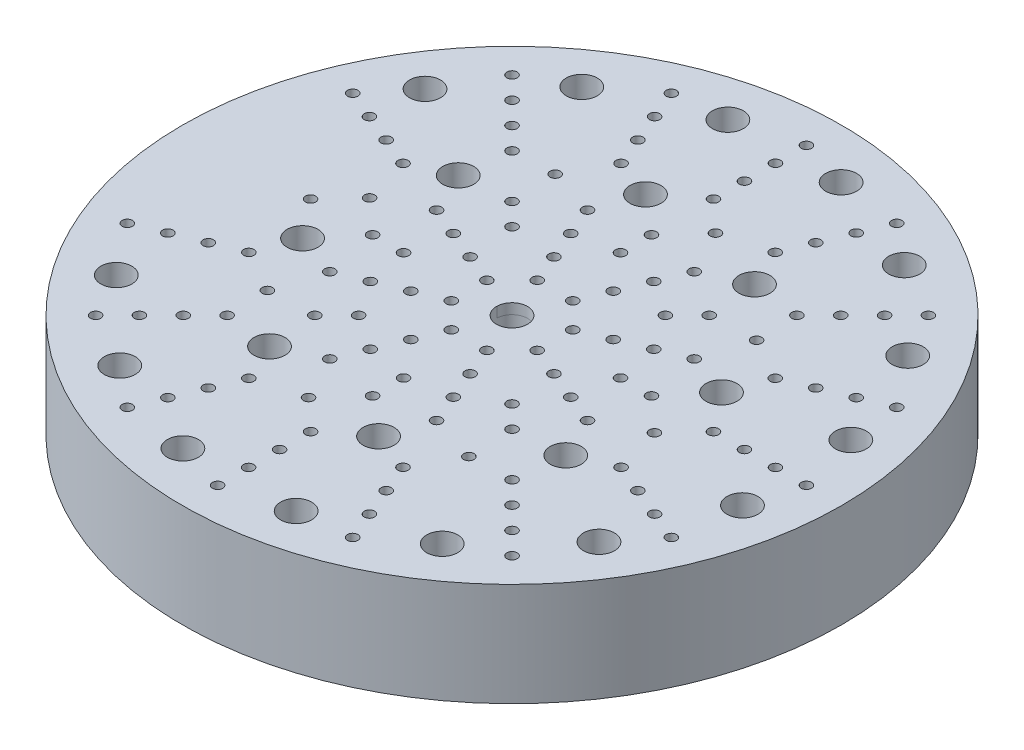
from build123d import *
from OCP.BRepAlgoAPI import BRepAlgoAPI_Cut
from OCP.TopTools import TopTools_ListOfShape
from build123d.topology import SkipClean

# Parameters (mm, degrees)
SKETCH2_R           = 31.9
SKETCH2_R_2         = 1.5
BOSS_EXTRUDE1_DEPTH = 5
CUT_EXTRUDE3_START  = -40
SKETCH3_R           = 3.5
CUT_EXTRUDE3_DEPTH  = 9
SHELL6_START        = -4.26
SHELL6_OUTLINE_R    = 2.24
SHELL6_DEPTH        = 8.52
SHELL6_START_2      = 2.834074074
SHELL6_2_DEPTH      = 1.425925926
SHELL6_3_DEPTH      = 1.425921957
SHELL6_START_3      = -31.1600001
SHELL6_4_DEPTH      = 0.1600001
SKETCH5_R           = 0.5
SKETCH5_R_2         = 1.5
CUT_EXTRUDE4_DEPTH  = 1
BOSS_EXTRUDE2_START = -31.9
SKETCH6_R           = 5
SKETCH6_R_2         = 3
BOSS_EXTRUDE2_DEPTH = 7.5
THREAD1_PITCH       = 1


with BuildPart() as part:
    # Sketch2 → Boss-Extrude1 (new, symmetric)
    with BuildSketch(Plane(origin=(0, 0, 0), x_dir=(1, 0, 0), z_dir=(0, 1, 0))):
        with Locations(Location((0, 0, 0), (0, 0, 270))):
            Circle(SKETCH2_R)
        with Locations(Location((0, 0, 0), (0, 0, 270))):
            Circle(SKETCH2_R_2, mode=Mode.SUBTRACT)
        with Locations(Location((-4.775324886, -27.082213208, 0), (0, 0, 270))):
            Circle(SKETCH2_R_2, mode=Mode.SUBTRACT)
        with Locations(Location((-9.134093342, -14.337654579, 0), (0, 0, 270))):
            Circle(SKETCH2_R_2, mode=Mode.SUBTRACT)
        with Locations(Location((-14.77573923, -23.19326476, 0), (0, 0, 270))):
            Circle(SKETCH2_R_2, mode=Mode.SUBTRACT)
        with Locations(Location((-22.526681218, -15.773352, 0), (0, 0, 270))):
            Circle(SKETCH2_R_2, mode=Mode.SUBTRACT)
        with Locations(Location((-16.597032121, -3.679473437, 0), (0, 0, 270))):
            Circle(SKETCH2_R_2, mode=Mode.SUBTRACT)
        with Locations(Location((-14.337654579, 9.134093342, 0), (0, 0, 270))):
            Circle(SKETCH2_R_2, mode=Mode.SUBTRACT)
        with Locations(Location((-23.19326476, 14.77573923, 0), (0, 0, 270))):
            Circle(SKETCH2_R_2, mode=Mode.SUBTRACT)
        with Locations(Location((-15.773352, 22.526681218, 0), (0, 0, 270))):
            Circle(SKETCH2_R_2, mode=Mode.SUBTRACT)
        with Locations(Location((-3.679473437, 16.597032121, 0), (0, 0, 270))):
            Circle(SKETCH2_R_2, mode=Mode.SUBTRACT)
        with Locations(Location((-5.952089383, 26.848140196, 0), (0, 0, 270))):
            Circle(SKETCH2_R_2, mode=Mode.SUBTRACT)
        with Locations(Location((4.775324886, 27.082213208, 0), (0, 0, 270))):
            Circle(SKETCH2_R_2, mode=Mode.SUBTRACT)
        with Locations(Location((9.134093342, 14.337654579, 0), (0, 0, 270))):
            Circle(SKETCH2_R_2, mode=Mode.SUBTRACT)
        with Locations(Location((14.77573923, 23.19326476, 0), (0, 0, 270))):
            Circle(SKETCH2_R_2, mode=Mode.SUBTRACT)
        with Locations(Location((22.526681218, 15.773352, 0), (0, 0, 270))):
            Circle(SKETCH2_R_2, mode=Mode.SUBTRACT)
        with Locations(Location((16.597032121, 3.679473437, 0), (0, 0, 270))):
            Circle(SKETCH2_R_2, mode=Mode.SUBTRACT)
        with Locations(Location((26.848140196, 5.952089383, 0), (0, 0, 270))):
            Circle(SKETCH2_R_2, mode=Mode.SUBTRACT)
        with Locations(Location((27.082213208, -4.775324886, 0), (0, 0, 270))):
            Circle(SKETCH2_R_2, mode=Mode.SUBTRACT)
        with Locations(Location((14.337654579, -9.134093342, 0), (0, 0, 270))):
            Circle(SKETCH2_R_2, mode=Mode.SUBTRACT)
        with Locations(Location((23.19326476, -14.77573923, 0), (0, 0, 270))):
            Circle(SKETCH2_R_2, mode=Mode.SUBTRACT)
        with Locations(Location((15.773352, -22.526681218, 0), (0, 0, 270))):
            Circle(SKETCH2_R_2, mode=Mode.SUBTRACT)
        with Locations(Location((3.679473437, -16.597032121, 0), (0, 0, 270))):
            Circle(SKETCH2_R_2, mode=Mode.SUBTRACT)
        with Locations(Location((5.952089383, -26.848140196, 0), (0, 0, 270))):
            Circle(SKETCH2_R_2, mode=Mode.SUBTRACT)
    extrude(amount=BOSS_EXTRUDE1_DEPTH, both=True)

    # Sketch3 → Cut-Extrude3 (cut)
    with BuildSketch(Plane(origin=(0, 0, 0), x_dir=(0, 0, -1), z_dir=(1, 0, 0)).offset(CUT_EXTRUDE3_START)):
        with Locations(Location((0, 0, 0), (0, 0, 180))):
            Circle(SKETCH3_R)
    extrude(amount=CUT_EXTRUDE3_DEPTH, mode=Mode.SUBTRACT)


with BuildPart() as shell6_tool:
    # Shell6: read off the stored shape, not the designer's step
    # Shell6 outline → Shell6 (new body)
    with BuildSketch(Plane(origin=(0, 0, 0), x_dir=(1, 0, 0), z_dir=(0, 1, 0)).offset(SHELL6_START)):
        with BuildLine():
            Line((-31, 3.153664535), (-31, -3.153664535))
            ThreePointArc((-31, -3.153664535), (31.16, 0), (-31, 3.153664535))
        make_face()
        with Locations((-22.526681218, -15.773352)):
            Circle(SHELL6_OUTLINE_R, mode=Mode.SUBTRACT)
        with Locations((-4.775324886, -27.082213208)):
            Circle(SHELL6_OUTLINE_R, mode=Mode.SUBTRACT)
        with Locations((-14.77573923, -23.19326476)):
            Circle(SHELL6_OUTLINE_R, mode=Mode.SUBTRACT)
        with Locations((-16.597032121, -3.679473437)):
            Circle(SHELL6_OUTLINE_R, mode=Mode.SUBTRACT)
        with Locations((-9.134093342, -14.337654579)):
            Circle(SHELL6_OUTLINE_R, mode=Mode.SUBTRACT)
        with Locations((5.952089383, -26.848140196)):
            Circle(SHELL6_OUTLINE_R, mode=Mode.SUBTRACT)
        with Locations((3.679473437, -16.597032121)):
            Circle(SHELL6_OUTLINE_R, mode=Mode.SUBTRACT)
        with Locations((15.773352, -22.526681218)):
            Circle(SHELL6_OUTLINE_R, mode=Mode.SUBTRACT)
        with Locations((14.337654579, -9.134093342)):
            Circle(SHELL6_OUTLINE_R, mode=Mode.SUBTRACT)
        with Locations((23.19326476, -14.77573923)):
            Circle(SHELL6_OUTLINE_R, mode=Mode.SUBTRACT)
        with Locations((27.082213208, -4.775324886)):
            Circle(SHELL6_OUTLINE_R, mode=Mode.SUBTRACT)
        with Locations((-23.19326476, 14.77573923)):
            Circle(SHELL6_OUTLINE_R, mode=Mode.SUBTRACT)
        with Locations((-14.337654579, 9.134093342)):
            Circle(SHELL6_OUTLINE_R, mode=Mode.SUBTRACT)
        with Locations((-15.773352, 22.526681218)):
            Circle(SHELL6_OUTLINE_R, mode=Mode.SUBTRACT)
        with Locations((-3.679473437, 16.597032121)):
            Circle(SHELL6_OUTLINE_R, mode=Mode.SUBTRACT)
        with Locations((-5.952089383, 26.848140196)):
            Circle(SHELL6_OUTLINE_R, mode=Mode.SUBTRACT)
        Circle(SHELL6_OUTLINE_R, mode=Mode.SUBTRACT)
        with Locations((9.134093342, 14.337654579)):
            Circle(SHELL6_OUTLINE_R, mode=Mode.SUBTRACT)
        with Locations((16.597032121, 3.679473437)):
            Circle(SHELL6_OUTLINE_R, mode=Mode.SUBTRACT)
        with Locations((26.848140196, 5.952089383)):
            Circle(SHELL6_OUTLINE_R, mode=Mode.SUBTRACT)
        with Locations((14.77573923, 23.19326476)):
            Circle(SHELL6_OUTLINE_R, mode=Mode.SUBTRACT)
        with Locations((4.775324886, 27.082213208)):
            Circle(SHELL6_OUTLINE_R, mode=Mode.SUBTRACT)
        with Locations((22.526681218, 15.773352)):
            Circle(SHELL6_OUTLINE_R, mode=Mode.SUBTRACT)
    extrude(amount=SHELL6_DEPTH)


with BuildPart() as part_1:
    add(part.part)

    # Shell6: cut by shell6_tool, with a tolerance
    shell6_stock = TopTools_ListOfShape()
    shell6_stock.Append(part_1.part.wrapped)
    shell6_tools = TopTools_ListOfShape()
    shell6_tools.Append(shell6_tool.part.wrapped)
    shell6_cut = BRepAlgoAPI_Cut()
    shell6_cut.SetArguments(shell6_stock)
    shell6_cut.SetTools(shell6_tools)
    shell6_cut.SetFuzzyValue(0.00001)
    shell6_cut.Build()
    add(Compound.cast(shell6_cut.Shape()).solids(), mode=Mode.REPLACE)


with BuildPart() as shell6_2_tool:
    # Shell6 2 outline → Shell6 2 (new body)
    with BuildSketch(Plane(origin=(0, 0, 0), x_dir=(1, 0, 0), z_dir=(0, 1, 0)).offset(SHELL6_START_2)):
        with BuildLine():
            ThreePointArc((-31, 3.153664535), (-31.16, 0), (-31, -3.153664535))
            Line((-31, -3.153664535), (-31, 3.153664535))
        make_face()
    extrude(amount=SHELL6_2_DEPTH)


with BuildPart() as part_2:
    add(part_1.part)

    # Shell6 2: cut by shell6_2_tool, with a tolerance
    shell6_2_stock = TopTools_ListOfShape()
    shell6_2_stock.Append(part_2.part.wrapped)
    shell6_2_tools = TopTools_ListOfShape()
    shell6_2_tools.Append(shell6_2_tool.part.wrapped)
    shell6_2_cut = BRepAlgoAPI_Cut()
    shell6_2_cut.SetArguments(shell6_2_stock)
    shell6_2_cut.SetTools(shell6_2_tools)
    shell6_2_cut.SetFuzzyValue(0.00001)
    shell6_2_cut.Build()
    add(Compound.cast(shell6_2_cut.Shape()).solids(), mode=Mode.REPLACE)


with BuildPart() as shell6_3_tool:
    # Shell6 3 outline → Shell6 3 (new body)
    with BuildSketch(Plane(origin=(0, 0, 0), x_dir=(1, 0, 0), z_dir=(0, 1, 0)).offset(SHELL6_START)):
        with BuildLine():
            ThreePointArc((-31, 3.153664535), (-31.16, 0), (-31, -3.153664535))
            Line((-31, -3.153664535), (-31, 3.153664535))
        make_face()
    extrude(amount=SHELL6_3_DEPTH)


with BuildPart() as part_3:
    add(part_2.part)

    # Shell6 3: cut by shell6_3_tool, with a tolerance
    shell6_3_stock = TopTools_ListOfShape()
    shell6_3_stock.Append(part_3.part.wrapped)
    shell6_3_tools = TopTools_ListOfShape()
    shell6_3_tools.Append(shell6_3_tool.part.wrapped)
    shell6_3_cut = BRepAlgoAPI_Cut()
    shell6_3_cut.SetArguments(shell6_3_stock)
    shell6_3_cut.SetTools(shell6_3_tools)
    shell6_3_cut.SetFuzzyValue(0.00001)
    shell6_3_cut.Build()
    add(Compound.cast(shell6_3_cut.Shape()).solids(), mode=Mode.REPLACE)


with BuildPart() as shell6_4_tool:
    # Shell6 4 outline → Shell6 4 (new body)
    with BuildSketch(Plane.YZ.offset(SHELL6_START_3)):
        with BuildLine():
            ThreePointArc((2.834074074, 2.053782886), (3.5, 0), (2.834074074, -2.053782886))
            Line((2.834074074, -2.053782886), (2.834078333, -3.153664535))
            ThreePointArc((2.834078333, -3.153664535), (4.24, 2.3e-08), (2.834078299, 3.153664566))
            Line((2.834078299, 3.153664566), (2.834074074, 2.053782886))
        make_face()
        with BuildLine():
            ThreePointArc((-2.834078043, -2.053777409), (-3.5, 0), (-2.834078043, 2.053777409))
            Line((-2.834078043, 2.053777409), (-2.834078327, 3.15366454))
            ThreePointArc((-2.834078327, 3.15366454), (-4.24, 4e-09), (-2.834078333, -3.153664535))
            Line((-2.834078333, -3.153664535), (-2.834078043, -2.053777409))
        make_face()
    extrude(amount=SHELL6_4_DEPTH)


with BuildPart() as part_4:
    add(part_3.part)


with BuildPart() as part_5:
    # Shell6 4: joined with shell6_4_tool
    add(part_4.part.fuse(shell6_4_tool.part, tol=0.00001))

    # Sketch5 → Cut-Extrude4 (cut)
    with BuildSketch(Plane(origin=(0, 5, 0), x_dir=(1, 0, 0), z_dir=(0, 1, 0))):
        with Locations(Location((2.9644e-05, -28.498661332, 0), (0, 0, 270))):
            Circle(SKETCH5_R)
        with Locations(Location((2.9644e-05, -25.498661332, 0), (0, 0, 270))):
            Circle(SKETCH5_R)
        with Locations(Location((2.9644e-05, -22.498661332, 0), (0, 0, 270))):
            Circle(SKETCH5_R)
        with Locations(Location((2.9644e-05, -19.498661332, 0), (0, 0, 270))):
            Circle(SKETCH5_R)
        with Locations(Location((2.9644e-05, -13.498661332, 0), (0, 0, 270))):
            Circle(SKETCH5_R)
        with Locations(Location((2.9644e-05, -10.498661332, 0), (0, 0, 270))):
            Circle(SKETCH5_R)
        with Locations(Location((-1.722045801, -4.156119228, 0), (0, 0, 270))):
            Circle(SKETCH5_R)
        with Locations(Location((-2.870096099, -6.927757826, 0), (0, 0, 270))):
            Circle(SKETCH5_R)
        with Locations(Location((-4.018146396, -9.699396423, 0), (0, 0, 270))):
            Circle(SKETCH5_R)
        with Locations(Location((-5.166196693, -12.471035021, 0), (0, 0, 270))):
            Circle(SKETCH5_R)
        with Locations(Location((-7.462297287, -18.014312216, 0), (0, 0, 270))):
            Circle(SKETCH5_R)
        with Locations(Location((-8.610347584, -20.785950813, 0), (0, 0, 270))):
            Circle(SKETCH5_R)
        with Locations(Location((-9.758397881, -23.557589411, 0), (0, 0, 270))):
            Circle(SKETCH5_R)
        with Locations(Location((-10.906448178, -26.329228008, 0), (0, 0, 270))):
            Circle(SKETCH5_R)
        with Locations(Location((-7.424591558, -7.423282534, 0), (0, 0, 270))):
            Circle(SKETCH5_R)
        with Locations(Location((-9.545911902, -9.544602878, 0), (0, 0, 270))):
            Circle(SKETCH5_R)
        with Locations(Location((-13.788552589, -13.787243565, 0), (0, 0, 270))):
            Circle(SKETCH5_R)
        with Locations(Location((-15.909872932, -15.908563908, 0), (0, 0, 270))):
            Circle(SKETCH5_R)
        with Locations(Location((-18.031193276, -18.029884252, 0), (0, 0, 270))):
            Circle(SKETCH5_R)
        with Locations(Location((-20.15251362, -20.151204596, 0), (0, 0, 270))):
            Circle(SKETCH5_R)
        with Locations(Location((-4.157428252, -1.720736777, 0), (0, 0, 270))):
            Circle(SKETCH5_R)
        with Locations(Location((-6.92906685, -2.868787074, 0), (0, 0, 270))):
            Circle(SKETCH5_R)
        with Locations(Location((-9.700705447, -4.016837372, 0), (0, 0, 270))):
            Circle(SKETCH5_R)
        with Locations(Location((-12.472344045, -5.164887669, 0), (0, 0, 270))):
            Circle(SKETCH5_R)
        with Locations(Location((-18.01562124, -7.460988263, 0), (0, 0, 270))):
            Circle(SKETCH5_R)
        with Locations(Location((-20.787259837, -8.60903856, 0), (0, 0, 270))):
            Circle(SKETCH5_R)
        with Locations(Location((-23.558898435, -9.757088857, 0), (0, 0, 270))):
            Circle(SKETCH5_R)
        with Locations(Location((-26.330537032, -10.905139154, 0), (0, 0, 270))):
            Circle(SKETCH5_R)
        with Locations(Location((-10.499970356, 0.001338668, 0), (0, 0, 270))):
            Circle(SKETCH5_R)
        with Locations(Location((-13.499970356, 0.001338668, 0), (0, 0, 270))):
            Circle(SKETCH5_R)
        with Locations(Location((-19.499970356, 0.001338668, 0), (0, 0, 270))):
            Circle(SKETCH5_R)
        with Locations(Location((-4.157428252, 1.723414114, 0), (0, 0, 270))):
            Circle(SKETCH5_R)
        with Locations(Location((-6.92906685, 2.871464411, 0), (0, 0, 270))):
            Circle(SKETCH5_R)
        with Locations(Location((-9.700705447, 4.019514708, 0), (0, 0, 270))):
            Circle(SKETCH5_R)
        with Locations(Location((-12.472344045, 5.167565005, 0), (0, 0, 270))):
            Circle(SKETCH5_R)
        with Locations(Location((-18.01562124, 7.463665599, 0), (0, 0, 270))):
            Circle(SKETCH5_R)
        with Locations(Location((-20.787259837, 8.611715897, 0), (0, 0, 270))):
            Circle(SKETCH5_R)
        with Locations(Location((-23.558898435, 9.759766194, 0), (0, 0, 270))):
            Circle(SKETCH5_R)
        with Locations(Location((-26.330537032, 10.907816491, 0), (0, 0, 270))):
            Circle(SKETCH5_R)
        with Locations(Location((-7.424591558, 7.425959871, 0), (0, 0, 270))):
            Circle(SKETCH5_R)
        with Locations(Location((-9.545911902, 9.547280214, 0), (0, 0, 270))):
            Circle(SKETCH5_R)
        with Locations(Location((-13.788552589, 13.789920901, 0), (0, 0, 270))):
            Circle(SKETCH5_R)
        with Locations(Location((-15.909872932, 15.911241245, 0), (0, 0, 270))):
            Circle(SKETCH5_R)
        with Locations(Location((-18.031193276, 18.032561589, 0), (0, 0, 270))):
            Circle(SKETCH5_R)
        with Locations(Location((-20.15251362, 20.153881932, 0), (0, 0, 270))):
            Circle(SKETCH5_R)
        with Locations(Location((-1.722045801, 4.158796565, 0), (0, 0, 270))):
            Circle(SKETCH5_R)
        with Locations(Location((-2.870096099, 6.930435162, 0), (0, 0, 270))):
            Circle(SKETCH5_R)
        with Locations(Location((-4.018146396, 9.70207376, 0), (0, 0, 270))):
            Circle(SKETCH5_R)
        with Locations(Location((-5.166196693, 12.473712357, 0), (0, 0, 270))):
            Circle(SKETCH5_R)
        with Locations(Location((-7.462297287, 18.016989552, 0), (0, 0, 270))):
            Circle(SKETCH5_R)
        with Locations(Location((-8.610347584, 20.78862815, 0), (0, 0, 270))):
            Circle(SKETCH5_R)
        with Locations(Location((-9.758397881, 23.560266747, 0), (0, 0, 270))):
            Circle(SKETCH5_R)
        with Locations(Location((-10.906448178, 26.331905345, 0), (0, 0, 270))):
            Circle(SKETCH5_R)
        with Locations(Location((2.9644e-05, 10.501338668, 0), (0, 0, 270))):
            Circle(SKETCH5_R)
        with Locations(Location((2.9644e-05, 13.501338668, 0), (0, 0, 270))):
            Circle(SKETCH5_R)
        with Locations(Location((2.9644e-05, 19.501338668, 0), (0, 0, 270))):
            Circle(SKETCH5_R)
        with Locations(Location((2.9644e-05, 22.501338668, 0), (0, 0, 270))):
            Circle(SKETCH5_R)
        with Locations(Location((2.9644e-05, 25.501338668, 0), (0, 0, 270))):
            Circle(SKETCH5_R)
        with Locations(Location((2.9644e-05, 28.501338668, 0), (0, 0, 270))):
            Circle(SKETCH5_R)
        with Locations(Location((1.72210509, 4.158796565, 0), (0, 0, 270))):
            Circle(SKETCH5_R)
        with Locations(Location((2.870155387, 6.930435162, 0), (0, 0, 270))):
            Circle(SKETCH5_R)
        with Locations(Location((4.018205684, 9.70207376, 0), (0, 0, 270))):
            Circle(SKETCH5_R)
        with Locations(Location((5.166255981, 12.473712357, 0), (0, 0, 270))):
            Circle(SKETCH5_R)
        with Locations(Location((7.462356575, 18.016989552, 0), (0, 0, 270))):
            Circle(SKETCH5_R)
        with Locations(Location((8.610406872, 20.78862815, 0), (0, 0, 270))):
            Circle(SKETCH5_R)
        with Locations(Location((9.75845717, 23.560266747, 0), (0, 0, 270))):
            Circle(SKETCH5_R)
        with Locations(Location((10.906507467, 26.331905345, 0), (0, 0, 270))):
            Circle(SKETCH5_R)
        with Locations(Location((7.424650847, 7.425959871, 0), (0, 0, 270))):
            Circle(SKETCH5_R)
        with Locations(Location((9.54597119, 9.547280214, 0), (0, 0, 270))):
            Circle(SKETCH5_R)
        with Locations(Location((13.788611877, 13.789920901, 0), (0, 0, 270))):
            Circle(SKETCH5_R)
        with Locations(Location((15.909932221, 15.911241245, 0), (0, 0, 270))):
            Circle(SKETCH5_R)
        with Locations(Location((18.031252564, 18.032561589, 0), (0, 0, 270))):
            Circle(SKETCH5_R)
        with Locations(Location((20.152572908, 20.153881932, 0), (0, 0, 270))):
            Circle(SKETCH5_R)
        with Locations(Location((4.157487541, 1.723414114, 0), (0, 0, 270))):
            Circle(SKETCH5_R)
        with Locations(Location((6.929126138, 2.871464411, 0), (0, 0, 270))):
            Circle(SKETCH5_R)
        with Locations(Location((9.700764736, 4.019514708, 0), (0, 0, 270))):
            Circle(SKETCH5_R)
        with Locations(Location((12.472403333, 5.167565005, 0), (0, 0, 270))):
            Circle(SKETCH5_R)
        with Locations(Location((18.015680528, 7.463665599, 0), (0, 0, 270))):
            Circle(SKETCH5_R)
        with Locations(Location((20.787319126, 8.611715897, 0), (0, 0, 270))):
            Circle(SKETCH5_R)
        with Locations(Location((23.558957723, 9.759766194, 0), (0, 0, 270))):
            Circle(SKETCH5_R)
        with Locations(Location((26.330596321, 10.907816491, 0), (0, 0, 270))):
            Circle(SKETCH5_R)
        with Locations(Location((10.500029644, 0.001338668, 0), (0, 0, 270))):
            Circle(SKETCH5_R)
        with Locations(Location((13.500029644, 0.001338668, 0), (0, 0, 270))):
            Circle(SKETCH5_R)
        with Locations(Location((19.500029644, 0.001338668, 0), (0, 0, 270))):
            Circle(SKETCH5_R)
        with Locations(Location((22.500029644, 0.001338668, 0), (0, 0, 270))):
            Circle(SKETCH5_R)
        with Locations(Location((25.500029644, 0.001338668, 0), (0, 0, 270))):
            Circle(SKETCH5_R)
        with Locations(Location((28.500029644, 0.001338668, 0), (0, 0, 270))):
            Circle(SKETCH5_R)
        with Locations(Location((4.157487541, -1.720736777, 0), (0, 0, 270))):
            Circle(SKETCH5_R)
        with Locations(Location((6.929126138, -2.868787074, 0), (0, 0, 270))):
            Circle(SKETCH5_R)
        with Locations(Location((9.700764736, -4.016837372, 0), (0, 0, 270))):
            Circle(SKETCH5_R)
        with Locations(Location((12.472403333, -5.164887669, 0), (0, 0, 270))):
            Circle(SKETCH5_R)
        with Locations(Location((18.015680528, -7.460988263, 0), (0, 0, 270))):
            Circle(SKETCH5_R)
        with Locations(Location((20.787319126, -8.60903856, 0), (0, 0, 270))):
            Circle(SKETCH5_R)
        with Locations(Location((23.558957723, -9.757088857, 0), (0, 0, 270))):
            Circle(SKETCH5_R)
        with Locations(Location((26.330596321, -10.905139154, 0), (0, 0, 270))):
            Circle(SKETCH5_R)
        with Locations(Location((7.424650847, -7.423282534, 0), (0, 0, 270))):
            Circle(SKETCH5_R)
        with Locations(Location((9.54597119, -9.544602878, 0), (0, 0, 270))):
            Circle(SKETCH5_R)
        with Locations(Location((13.788611877, -13.787243565, 0), (0, 0, 270))):
            Circle(SKETCH5_R)
        with Locations(Location((15.909932221, -15.908563908, 0), (0, 0, 270))):
            Circle(SKETCH5_R)
        with Locations(Location((18.031252564, -18.029884252, 0), (0, 0, 270))):
            Circle(SKETCH5_R)
        with Locations(Location((20.152572908, -20.151204596, 0), (0, 0, 270))):
            Circle(SKETCH5_R)
        with Locations(Location((1.72210509, -4.156119228, 0), (0, 0, 270))):
            Circle(SKETCH5_R)
        with Locations(Location((2.870155387, -6.927757826, 0), (0, 0, 270))):
            Circle(SKETCH5_R)
        with Locations(Location((4.018205684, -9.699396423, 0), (0, 0, 270))):
            Circle(SKETCH5_R)
        with Locations(Location((5.166255981, -12.471035021, 0), (0, 0, 270))):
            Circle(SKETCH5_R)
        with Locations(Location((7.462356575, -18.014312216, 0), (0, 0, 270))):
            Circle(SKETCH5_R)
        with Locations(Location((8.610406872, -20.785950813, 0), (0, 0, 270))):
            Circle(SKETCH5_R)
        with Locations(Location((9.75845717, -23.557589411, 0), (0, 0, 270))):
            Circle(SKETCH5_R)
        with Locations(Location((10.906507467, -26.329228008, 0), (0, 0, 270))):
            Circle(SKETCH5_R)
        with Locations((2.9644e-05, 0.001338668)):
            Circle(SKETCH5_R_2)
        with Locations((-16.597002477, -3.678134769)):
            Circle(SKETCH5_R)
        with Locations(Location((-16.741192127, 2.953244444, 0), (0, 0, 270))):
            Circle(SKETCH5_R)
        with Locations((-14.336687036, 9.135018962)):
            Circle(SKETCH5_R)
        with Locations(Location((-9.749551305, 13.926069651, 0), (0, 0, 270))):
            Circle(SKETCH5_R)
        with Locations((-3.678134769, 16.597002477)):
            Circle(SKETCH5_R)
        with Locations(Location((2.953244444, 16.741192127, 0), (0, 0, 270))):
            Circle(SKETCH5_R)
        with Locations((9.135018962, 14.336687036)):
            Circle(SKETCH5_R)
        with Locations(Location((13.926069651, 9.749551305, 0), (0, 0, 270))):
            Circle(SKETCH5_R)
        with Locations((16.597002477, 3.678134769)):
            Circle(SKETCH5_R)
        with Locations(Location((16.741192127, -2.953244444, 0), (0, 0, 270))):
            Circle(SKETCH5_R)
        with Locations((14.336687036, -9.135018962)):
            Circle(SKETCH5_R)
        with Locations(Location((9.749551305, -13.926069651, 0), (0, 0, 270))):
            Circle(SKETCH5_R)
        with Locations((3.678134769, -16.597002477)):
            Circle(SKETCH5_R)
        with Locations(Location((-2.953244444, -16.741192127, 0), (0, 0, 270))):
            Circle(SKETCH5_R)
        with Locations((-9.135018962, -14.336687036)):
            Circle(SKETCH5_R)
        with Locations(Location((-13.926069651, -9.749551305, 0), (0, 0, 270))):
            Circle(SKETCH5_R)
    extrude(amount=-CUT_EXTRUDE4_DEPTH, mode=Mode.SUBTRACT)

    # Sketch6 → Boss-Extrude2 (add)
    with SkipClean():  # the faces are left unmerged after this step: merging them gives an invalid solid
        with BuildSketch(Plane(origin=(0, 0, 0), x_dir=(0, 0, -1), z_dir=(1, 0, 0)).offset(BOSS_EXTRUDE2_START)):
            Circle(SKETCH6_R)
            Circle(SKETCH6_R_2, mode=Mode.SUBTRACT)
        extrude(amount=BOSS_EXTRUDE2_DEPTH)

    # Chamfer1: read off the stored shape, not the designer's step
    # Chamfer1 outline → Chamfer1 (revolve, cut)
    with SkipClean():  # the faces are left unmerged after this step: merging them gives an invalid solid
        with BuildSketch(Plane.YX):
            Polygon((4, -31.9), (3, -30.9), (3, -31.9), align=None)
        revolve(axis=Axis((0, 0, 0), (1, 0, 0)), mode=Mode.SUBTRACT)

    # Thread1: arcs per turn and ends read off the stored shape
    # Thread1: the profile of Thread Profile1 profile screwed along a right-hand helix through 9 turns, 8 arcs to a turn; built about Z, then put on its axis
    with SkipClean():  # the faces are left unmerged after this step: merging them gives an invalid solid
        thread1_z = Axis((0, 0, 0), (0, 0, 1))
        thread1_corners = [(2.9997, 0, -0.000173205), (3.541265875, 0, 0.312499999), (3.541265875, 0, 0.437499999), (2.9997, 0, 0.750173202)]
        with BuildLine(mode=Mode.PRIVATE) as thread1_profile:
            Line(thread1_corners[0], thread1_corners[1])
            Line(thread1_corners[1], thread1_corners[2])
            Line(thread1_corners[2], thread1_corners[3])
            Line(thread1_corners[3], thread1_corners[0])
        thread1_cap = Face(thread1_profile.wire())
        thread1_turn_angles = [0, 22.5, 45, 67.5, 90, 112.5, 135, 157.5, 180, 202.5, 225, 247.5, 270, 292.5, 315, 337.5, 360]
        thread1_turn_weights = [1, 0.9238795325112867, 1, 0.9238795325112867, 1, 0.9238795325112867, 1, 0.9238795325112867, 1, 0.9238795325112867, 1, 0.9238795325112867, 1, 0.9238795325112867, 1, 0.9238795325112867, 1]
        thread1_turn_rails = [Edge.make_bspline([Vector(p[0], p[1], 0).rotate(thread1_z, thread1_turn_angles[k]) / thread1_turn_weights[k] + Vector(0, 0, p[2] + THREAD1_PITCH * thread1_turn_angles[k] / 360) for k in range(17)], [0, 0, 0, 1, 1, 2, 2, 3, 3, 4, 4, 5, 5, 6, 6, 7, 7, 8, 8, 8], 2, thread1_turn_weights) for p in thread1_corners]
        thread1_turn_sides = [Face.make_surface_from_curves(thread1_turn_rails[p[0]], thread1_turn_rails[p[1]]) for p in [(0, 1), (1, 2), (2, 3), (3, 0)]]
        thread1 = Plane(origin=(-33.9, 0, 0), x_dir=(0, 0, -1), z_dir=(1, 0, 0)) * Solid(Shell([*[p.moved(Location((0, 0, THREAD1_PITCH * i))) for i in range(9) for p in thread1_turn_sides], thread1_cap, thread1_cap.rotate(thread1_z, 3240).moved(Location((0, 0, THREAD1_PITCH * 3240 / 360)))]))
        add(thread1, mode=Mode.SUBTRACT)


solid = part_5.part
